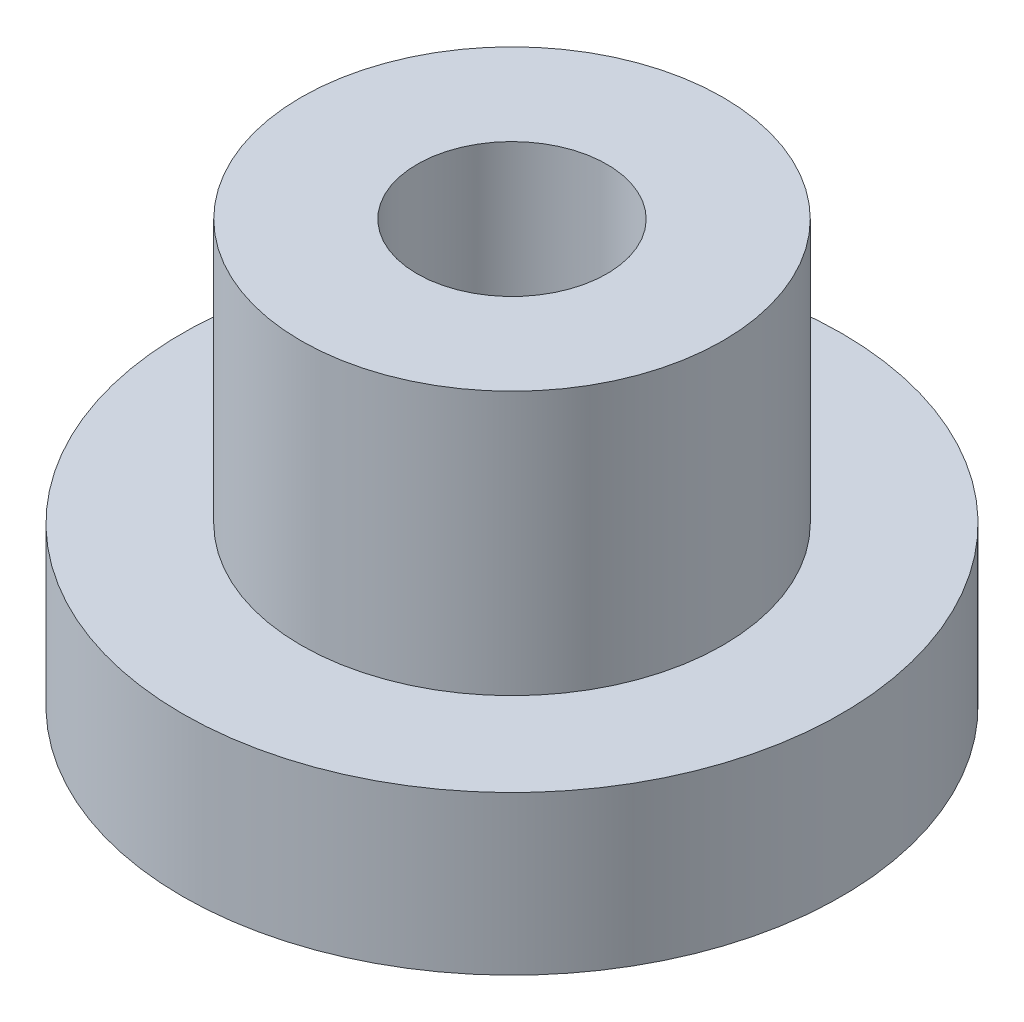
from build123d import *

# Parameters (mm, degrees)
SKETCH1_R                                            = 4
BOSS_EXTRUDE1_DEPTH                                  = 5
SKETCH2_R                                            = 6.25
BOSS_EXTRUDE2_DEPTH                                  = 3
SKETCH3_R                                            = 1.8
CUT_EXTRUDE1_DEPTH                                   = 12.921619018
CSK_FOR_M3_HEX_SOCKET_COUNTERSUNK_HEAD_S_D           = 3.6
CSK_FOR_M3_HEX_SOCKET_COUNTERSUNK_HEAD_S_CSINK_D     = 6.94
CSK_FOR_M3_HEX_SOCKET_COUNTERSUNK_HEAD_S_CSINK_ANGLE = 90


with BuildPart() as part:
    # Sketch1 → Boss-Extrude1 (new body)
    with BuildSketch(Plane(origin=(0, 0, 0), x_dir=(1, 0, 0), z_dir=(0, 1, 0))):
        Circle(SKETCH1_R)
    extrude(amount=BOSS_EXTRUDE1_DEPTH)

    # Sketch2 → Boss-Extrude2 (add)
    with BuildSketch(Plane.XZ):
        Circle(SKETCH2_R)
    extrude(amount=BOSS_EXTRUDE2_DEPTH)

    # Sketch3 → Cut-Extrude1 (cut, through all)
    with BuildSketch(Plane(origin=(0, 5, 0), x_dir=(1, 0, 0), z_dir=(0, 1, 0))):
        Circle(SKETCH3_R)
    extrude(amount=-CUT_EXTRUDE1_DEPTH, mode=Mode.SUBTRACT)

    # CSK for M3 Hex Socket Countersunk Head Screw1 (through all)
    with Locations(Plane(origin=(0, -3, 0), x_dir=(-1, 0, 0), z_dir=(0, -1, 0))):
        with Locations((0, 0)):
            CounterSinkHole(CSK_FOR_M3_HEX_SOCKET_COUNTERSUNK_HEAD_S_D / 2, CSK_FOR_M3_HEX_SOCKET_COUNTERSUNK_HEAD_S_CSINK_D / 2, counter_sink_angle=CSK_FOR_M3_HEX_SOCKET_COUNTERSUNK_HEAD_S_CSINK_ANGLE)


solid = part.part
